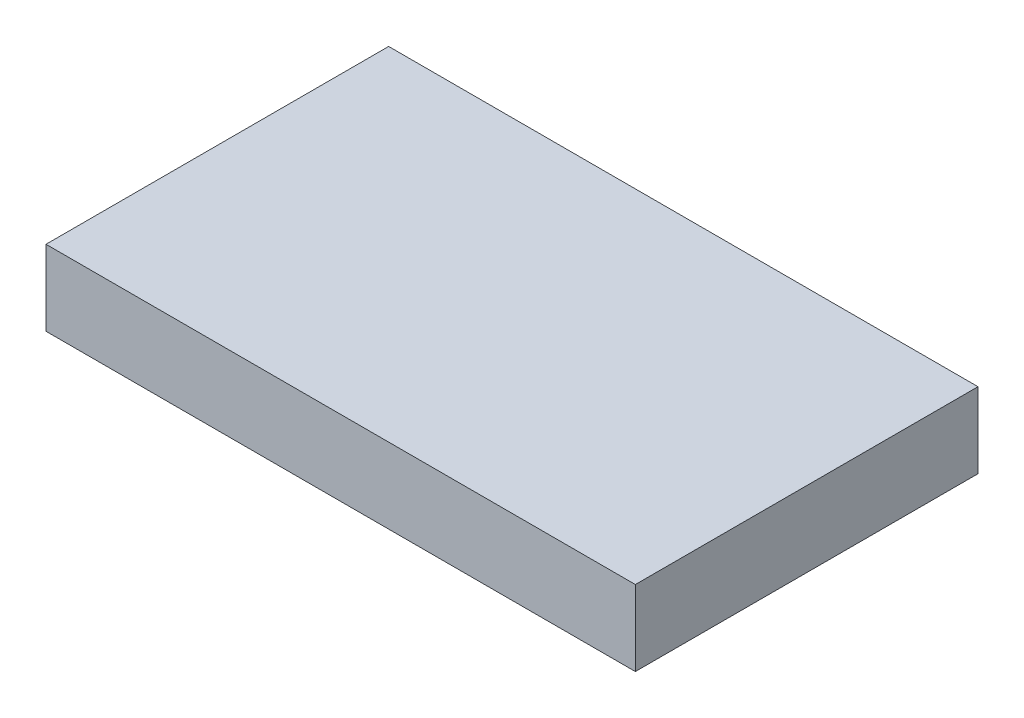
from build123d import *

# Parameters (mm, degrees)
SKETCH2_W           = 43.688
SKETCH2_H           = 25.4
BOSS_EXTRUDE1_DEPTH = 5.588


with BuildPart() as part:
    # Sketch2 → Boss-Extrude1 (new body)
    with BuildSketch(Plane(origin=(0, 0, 0), x_dir=(1, 0, 0), z_dir=(0, 1, 0))):
        Rectangle(SKETCH2_W, SKETCH2_H)
    extrude(amount=BOSS_EXTRUDE1_DEPTH)


solid = part.part
